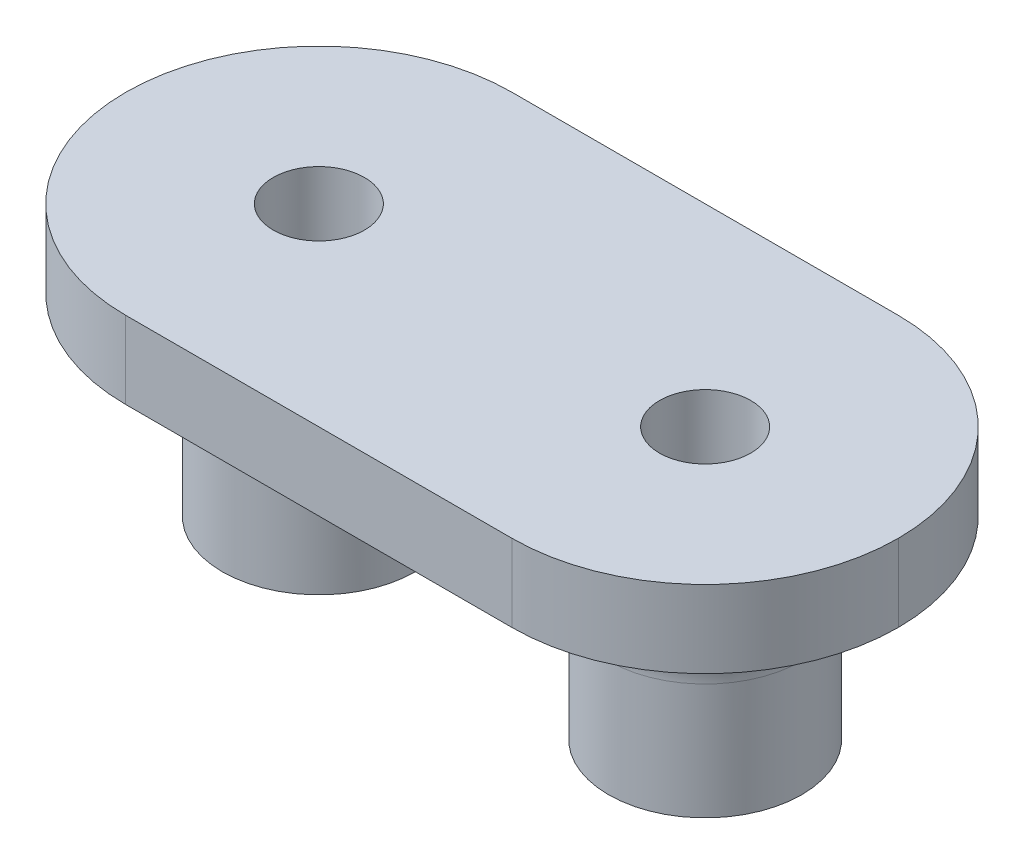
from build123d import *
from build123d.topology import SkipClean

# Parameters (mm, degrees)
SKETCH1_W           = 25.4
SKETCH1_H           = 25.4
SKETCH1_R           = 1.5
BOSS_EXTRUDE1_DEPTH = 2.54
SKETCH3_W           = 25.4
SKETCH3_H           = 12.7
CUT_EXTRUDE1_DEPTH  = 19.139228208
BOSS_EXTRUDE2_START = 6.35
SKETCH4_R           = 3.175
SKETCH4_R_2         = 1.5
BOSS_EXTRUDE2_DEPTH = 6.35
FILLET1_R           = 6.35


with BuildPart() as part:
    # Sketch1 → Boss-Extrude1 (new body)
    with BuildSketch(Plane(origin=(0, 0, 0), x_dir=(1, 0, 0), z_dir=(0, 1, 0))):
        Rectangle(SKETCH1_W, SKETCH1_H)
        with Locations(Location((-6.35, 6.35, 0), (0, 0, 270))):
            Circle(SKETCH1_R, mode=Mode.SUBTRACT)
        with Locations(Location((6.35, 6.35, 0), (0, 0, 270))):
            Circle(SKETCH1_R, mode=Mode.SUBTRACT)
        with Locations(Location((6.35, -6.35, 0), (0, 0, 270))):
            Circle(SKETCH1_R, mode=Mode.SUBTRACT)
        with Locations(Location((-6.35, -6.35, 0), (0, 0, 270))):
            Circle(SKETCH1_R, mode=Mode.SUBTRACT)
    extrude(amount=BOSS_EXTRUDE1_DEPTH)

    # Sketch3 → Cut-Extrude1 (cut, through all)
    with BuildSketch(Plane.XZ):
        with Locations((0, -6.35)):
            Rectangle(SKETCH3_W, SKETCH3_H)
    extrude(amount=-CUT_EXTRUDE1_DEPTH, mode=Mode.SUBTRACT)

    # Sketch4 → Boss-Extrude2 (add)
    # profile 1 of 2: a face of its own
    with SkipClean():  # the faces are left unmerged after this step: merging them gives an invalid solid
        with BuildSketch(Plane.XZ.offset(BOSS_EXTRUDE2_START)):
            with Locations(Location((-6.35, 6.35, 0), (0, 0, 90))):
                Circle(SKETCH4_R)
            with Locations(Location((-6.35, 6.35, 0), (0, 0, 270))):
                Circle(SKETCH4_R_2, mode=Mode.SUBTRACT)
        # profile 2 of 2: a face of its own
        with BuildSketch(Plane.XZ.offset(BOSS_EXTRUDE2_START)):
            with Locations(Location((6.35, 6.35, 0), (0, 0, 90))):
                Circle(SKETCH4_R)
            with Locations(Location((6.35, 6.35, 0), (0, 0, 270))):
                Circle(SKETCH4_R_2, mode=Mode.SUBTRACT)
        extrude(amount=-BOSS_EXTRUDE2_DEPTH)

    # Fillet1
    fillet1_edges = [part.edges().sort_by_distance(p)[0] for p in [
        (12.7, 1.27, 0),
        (-12.7, 1.27, 0),
        (-12.7, 1.27, 12.7),
        (12.7, 1.27, 12.7),
    ]]
    fillet(fillet1_edges, radius=FILLET1_R - 0.0001)  # a hair under: the kernel refuses the full size

    # Fillet2: read off the stored shape, not the designer's step
    # Fillet2 outline → Fillet2 (revolve)
    with BuildSketch(Plane(origin=(6.35, 0, 6.35), x_dir=(1, 0, 0), z_dir=(0, 0, 1))):
        with BuildLine():
            ThreePointArc((3.175, -2.54), (3.918948776, -0.743948776), (5.715, 0))
            Line((5.715, 0), (3.175, 0))
            Line((3.175, 0), (3.175, -2.54))
        make_face()
    revolve(axis=Axis((6.35, 0, 6.35), (0, 1, 0)))

    # Fillet2 2 outline → Fillet2 2 (revolve)
    with BuildSketch(Plane(origin=(-6.35, 0, 6.35), x_dir=(1, 0, 0), z_dir=(0, 0, 1))):
        with BuildLine():
            ThreePointArc((3.175, -2.54), (3.918948776, -0.743948776), (5.715, 0))
            Line((5.715, 0), (3.175, 0))
            Line((3.175, 0), (3.175, -2.54))
        make_face()
    revolve(axis=Axis((-6.35, 0, 6.35), (0, 1, 0)))


solid = part.part
